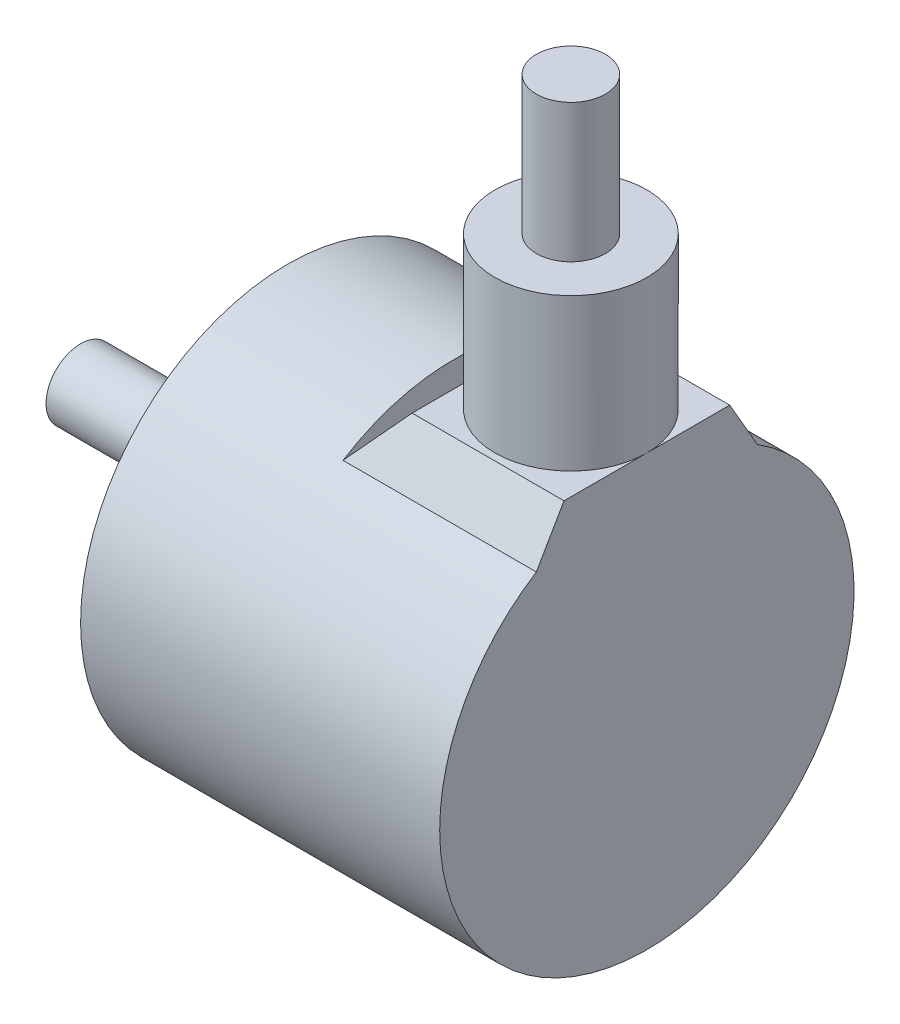
from build123d import *

# Parameters (mm, degrees)
ESQUISSE3_R                  = 1.5
ENL_V_MAT_EXTRU_1_DEPTH      = 5
R_P_TITION_CIRCULAIRE1_COUNT = 3
ESQUISSE4_R                  = 8
BOSS_EXTRU_1_DEPTH           = 2
BOSS_EXTRU_2_DEPTH           = 14
ENL_V_START                  = -8
ENL_V_MAT_EXTRU_2_DEPTH      = 16
ESQUISSE7_R                  = 5.5
BOSS_EXTRU_4_DEPTH           = 11
ESQUISSE8_R                  = 2.5
BOSS_EXTRU_5_DEPTH           = 10


# Read off the part's stored shape, not the designer's step: Enlèv. mat.-Extru.2
with BuildPart() as part:
    # Esquisse1 → Révolution1 (revolve)
    with BuildSketch(Plane.XY, mode=Mode.PRIVATE) as r_volution1_sk:
        Polygon((-13.555229236, 0), (-13.555229236, 15), (-39.555229236, 15), (-39.555229236, 2.5), (-54.555229236, 2.5), (-54.555229236, 0), align=None)
    revolve(r_volution1_sk.sketch.rotate(Axis((-72.521066027, 0, 0), (1, 0, 0)), 90), axis=Axis((-72.521066027, 0, 0), (1, 0, 0)))

    # Esquisse3 → Enlèv. mat.-Extru.1 (cut)
    with BuildSketch(Plane.ZY.offset(39.555229236)):
        with Locations((0, -12)):
            Circle(ESQUISSE3_R)
    enl_v_mat_extru_1 = extrude(amount=-ENL_V_MAT_EXTRU_1_DEPTH, mode=Mode.SUBTRACT)

    # Répétition circulaire1: Enlèv. mat.-Extru.1 ×3 about axis
    r_p_tition_circulaire1_axis = Axis((0, 0, 0), (1, 0, 0))
    for i in range(1, R_P_TITION_CIRCULAIRE1_COUNT):
        add(enl_v_mat_extru_1.rotate(r_p_tition_circulaire1_axis, i * 360 / R_P_TITION_CIRCULAIRE1_COUNT), mode=Mode.SUBTRACT)

    # Esquisse4 → Boss.-Extru.1 (add)
    with BuildSketch(Plane.ZY.offset(39.555229236)):
        with Locations(Location((0, 0, 0), (0, 0, 180))):
            Circle(ESQUISSE4_R)
    extrude(amount=BOSS_EXTRU_1_DEPTH)

    # Esquisse3D1 → Boss.-Extru.2 (add)
    with BuildSketch(Plane(origin=(-13.555229236, 12.68857754, 8), x_dir=(0, 0, -1), z_dir=(1, 0, 0))):
        Polygon((0, 0), (2, 3.464101615), (14, 3.464101615), (16, 0), align=None)
    extrude(amount=-BOSS_EXTRU_2_DEPTH)

    # Enlèv. mat.-Extru.2 outline → Enlèv. mat.-Extru.2 (cut)
    with BuildSketch(Plane.XY.offset(ENL_V_START)):
        Polygon((-27.555229236, 16.152679156), (-27.555229236, 12.68857754), (-24.555229236, 16.152679156), align=None)
    extrude(amount=ENL_V_MAT_EXTRU_2_DEPTH, mode=Mode.SUBTRACT)

    # Esquisse7 → Boss.-Extru.4 (add)
    with BuildSketch(Plane(origin=(0, 16.152679156, 0), x_dir=(1, 0, 0), z_dir=(0, 1, 0))):
        with Locations(Location((-19.055229236, 0, 0), (0, 0, 180))):
            Circle(ESQUISSE7_R)
    extrude(amount=BOSS_EXTRU_4_DEPTH)

    # Esquisse8 → Boss.-Extru.5 (add)
    with BuildSketch(Plane(origin=(0, 27.152679156, 0), x_dir=(1, 0, 0), z_dir=(0, 1, 0))):
        with Locations(Location((-19.055229236, 0, 0), (0, 0, 270))):
            Circle(ESQUISSE8_R)
    extrude(amount=BOSS_EXTRU_5_DEPTH)


solid = part.part
